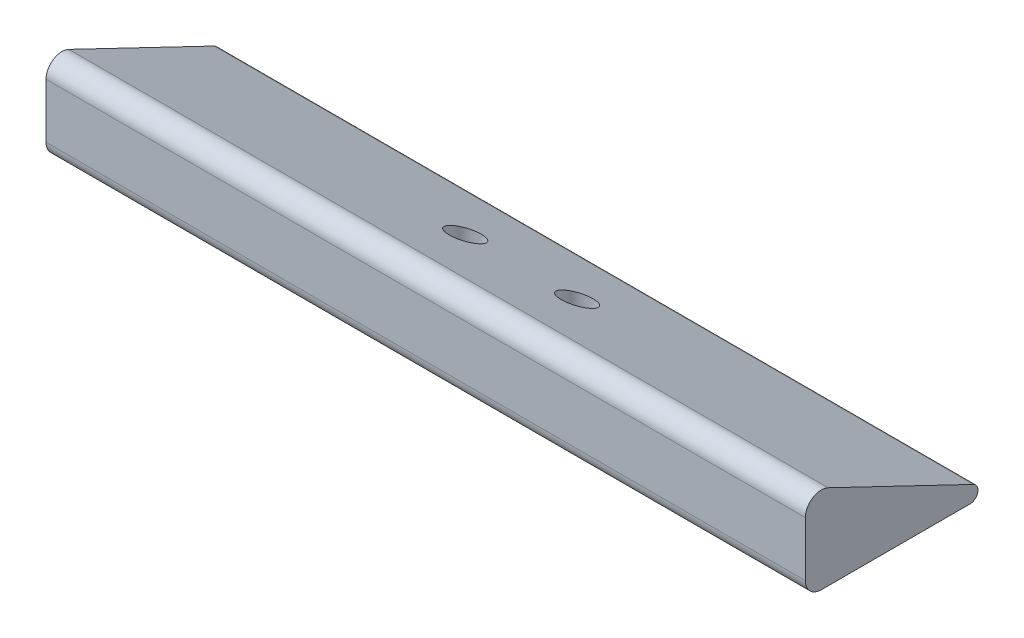
from build123d import *

# Parameters (mm, degrees)
BOSS_EXTRUDE1_DEPTH = 95
SKETCH2_R           = 2
CUT_EXTRUDE1_DEPTH  = 8
SKETCH3_R           = 1.5
CUT_EXTRUDE2_DEPTH  = 98.824477529


with BuildPart() as part:
    # Sketch1 → Boss-Extrude1 (new body)
    with BuildSketch(Plane(origin=(0, 0, 0), x_dir=(0, 0, -1), z_dir=(1, 0, 0))):
        with BuildLine():
            Line((2, 0), (20.605762563, 0))
            ThreePointArc((20.605762563, 0), (21.580832575, 0.778102566), (21.03849363, 1.901523057))
            Line((21.03849363, 1.901523057), (2.865462135, 10.624578175))
            ThreePointArc((2.865462135, 10.624578175), (0.934853125, 10.514299657), (0, 8.82153206))
            Line((0, 8.82153206), (0, 2))
            ThreePointArc((0, 2), (0.585786438, 0.585786438), (2, 0))
        make_face()
    extrude(amount=BOSS_EXTRUDE1_DEPTH)

    # Sketch2 → Cut-Extrude1 (cut)
    with BuildSketch(Plane(origin=(0, 10, 0), x_dir=(1, 0, 0), z_dir=(0, 1, 0))):
        with Locations((40.5, 11.951977883)):
            Circle(SKETCH2_R)
        with Locations((54.5, 11.951977883)):
            Circle(SKETCH2_R)
    extrude(amount=-CUT_EXTRUDE1_DEPTH, mode=Mode.SUBTRACT)

    # Sketch3 → Cut-Extrude2 (cut, through all)
    with BuildSketch(Plane(origin=(0, 2, 0), x_dir=(1, 0, 0), z_dir=(0, 1, 0))):
        with Locations((40.5, 11.951977883)):
            Circle(SKETCH3_R)
        with Locations((54.5, 11.951977883)):
            Circle(SKETCH3_R)
    extrude(amount=-CUT_EXTRUDE2_DEPTH, mode=Mode.SUBTRACT)


solid = part.part
